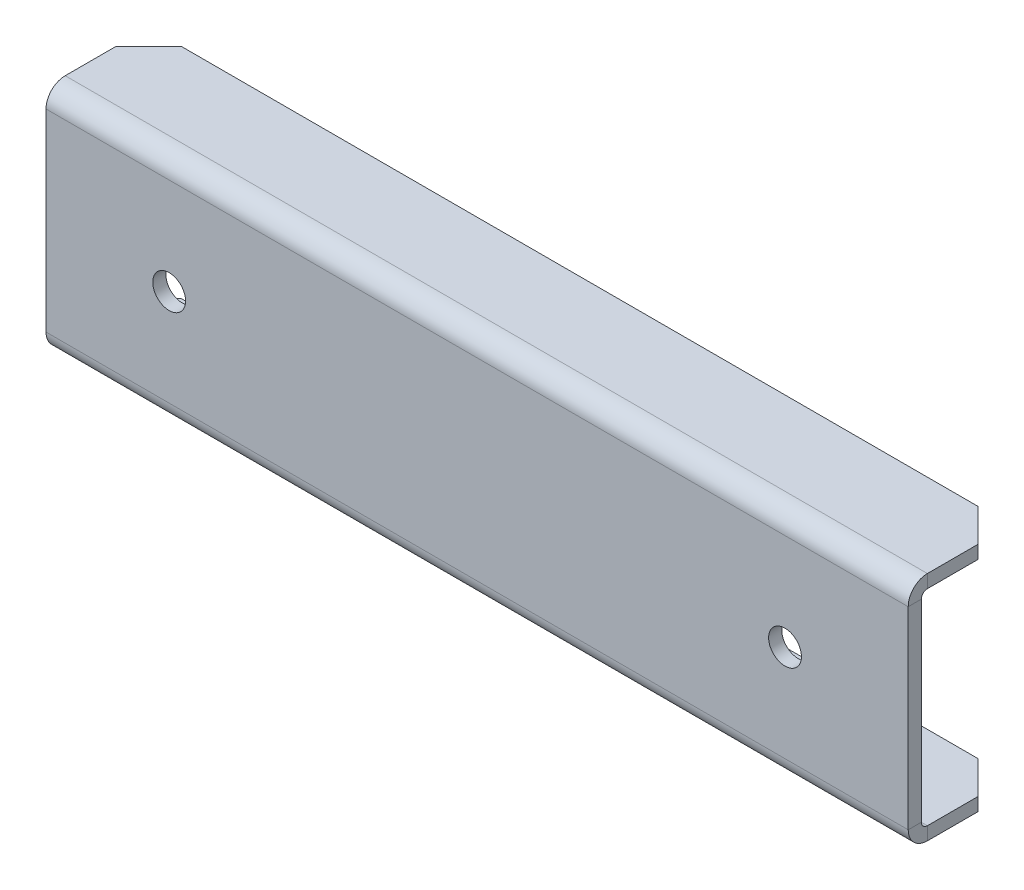
from build123d import *

# Parameters (mm, degrees)
SKETCH_1_W                         = 105
SKETCH_1_H                         = 25
SM_BASE_FLANGE_1_DEPTH             = 1.6
SM_EDGE_FLANGE_1_STRIP_W           = 7.8732
SM_EDGE_FLANGE_1_STRIP_H           = 1.6
SM_EDGE_FLANGE_1_STRIP_CUT_DEPTH   = 105
SM_EDGE_FLANGE_1_STRIP_2_W         = 7.8732
SM_EDGE_FLANGE_1_STRIP_2_H         = 1.6
SM_EDGE_FLANGE_1_STRIP_CUT_2_DEPTH = 105
SM_EDGE_FLANGE_1_DEPTH             = 105
SM_EDGE_FLANGE_1_BEND_DEPTH        = 105
CUT_EXTRUDE_1_DEPTH                = 56.779117956
CUT_EXTRUDE_1_DEPTH_BACK           = 56.779117956
SKETCH_13_R                        = 2
CUT_EXTRUDE_2_DEPTH                = 56.442492729


# Sheet-metal steps are written as plain solids
with BuildPart() as part:
    # Sketch 1 → 基体-法兰1 (new body)
    with BuildSketch(Plane.XY):
        Rectangle(SKETCH_1_W, SKETCH_1_H)
    extrude(amount=-SM_BASE_FLANGE_1_DEPTH)

    # 边线-法兰1 strip (across the edge) → 边线-法兰1 strip cut (cut)
    with BuildSketch(Plane(origin=(-52.5, 12.5, -1.6), x_dir=(0, -1, 0), z_dir=(1, 0, 0))):
        with Locations((-3.2, -0.8)):
            Rectangle(SM_EDGE_FLANGE_1_STRIP_W, SM_EDGE_FLANGE_1_STRIP_H)
    extrude(amount=SM_EDGE_FLANGE_1_STRIP_CUT_DEPTH, mode=Mode.SUBTRACT)

    # 边线-法兰1 strip 2 (across the edge) → 边线-法兰1 strip cut 2 (cut)
    with BuildSketch(Plane(origin=(52.5, -12.5, -1.6), x_dir=(0, 1, 0), z_dir=(-1, 0, 0))):
        with Locations((-3.2, -0.8)):
            Rectangle(SM_EDGE_FLANGE_1_STRIP_2_W, SM_EDGE_FLANGE_1_STRIP_2_H)
    extrude(amount=SM_EDGE_FLANGE_1_STRIP_CUT_2_DEPTH, mode=Mode.SUBTRACT)

    # 边线-法兰1 section (across the edge) → 边线-法兰1 (add)
    with BuildSketch(Plane(origin=(-52.5, 12.5, -1.6), x_dir=(0, -1, 0), z_dir=(1, 0, 0))):
        with BuildLine():
            Line((-1.6, 0.7366), (-1.6, 10.9))
            Line((-1.6, 10.9), (0, 10.9))
            Line((0, 10.9), (0, 0.7366))
            ThreePointArc((0, 0.7366), (0.215745145, 0.215745145), (0.7366, 0))
            Line((0.7366, 0), (0.7366, -1.6))
            ThreePointArc((0.7366, -1.6), (-0.915625705, -0.915625705), (-1.6, 0.7366))
        make_face()
    extrude(amount=SM_EDGE_FLANGE_1_DEPTH)

    # 边线-法兰1 section 2 (across the edge) → 边线-法兰1 bend (add)
    with BuildSketch(Plane(origin=(52.5, -12.5, -1.6), x_dir=(0, 1, 0), z_dir=(-1, 0, 0))):
        with BuildLine():
            Line((-1.6, 0.7366), (-1.6, 10.9))
            Line((-1.6, 10.9), (0, 10.9))
            Line((0, 10.9), (0, 0.7366))
            ThreePointArc((0, 0.7366), (0.215745145, 0.215745145), (0.7366, 0))
            Line((0.7366, 0), (0.7366, -1.6))
            ThreePointArc((0.7366, -1.6), (-0.915625705, -0.915625705), (-1.6, 0.7366))
        make_face()
    extrude(amount=SM_EDGE_FLANGE_1_BEND_DEPTH)

    # 草图12 → 切除-拉伸1 (cut, two sides: drawn at the far end of the back side and taken through both)
    with BuildSketch(Plane(origin=(0, 0, 0), x_dir=(1, 0, 0), z_dir=(0, 1, 0)).offset(-CUT_EXTRUDE_1_DEPTH_BACK)):
        Polygon((-52.5, 8.5), (-48.5, 12.5), (-52.5, 12.5), align=None)
        Polygon((48.5, 12.5), (52.5, 12.5), (52.5, 8.5), align=None)
    extrude(amount=CUT_EXTRUDE_1_DEPTH + CUT_EXTRUDE_1_DEPTH_BACK, mode=Mode.SUBTRACT)

    # 草图13 → 切除-拉伸2 (cut, through all)
    with BuildSketch(Plane(origin=(0, 0, -1.6), x_dir=(-1, 0, 0), z_dir=(0, 0, -1))):
        with Locations((-37.5, 0)):
            Circle(SKETCH_13_R)
    cut_extrude_2 = extrude(amount=-CUT_EXTRUDE_2_DEPTH, mode=Mode.SUBTRACT)

    # 镜向1: 切除-拉伸2 across plane
    add(cut_extrude_2.mirror(Plane(origin=(0, 0, 0), x_dir=(0, 0, 1), z_dir=(1, 0, 0))), mode=Mode.SUBTRACT)


solid = part.part
